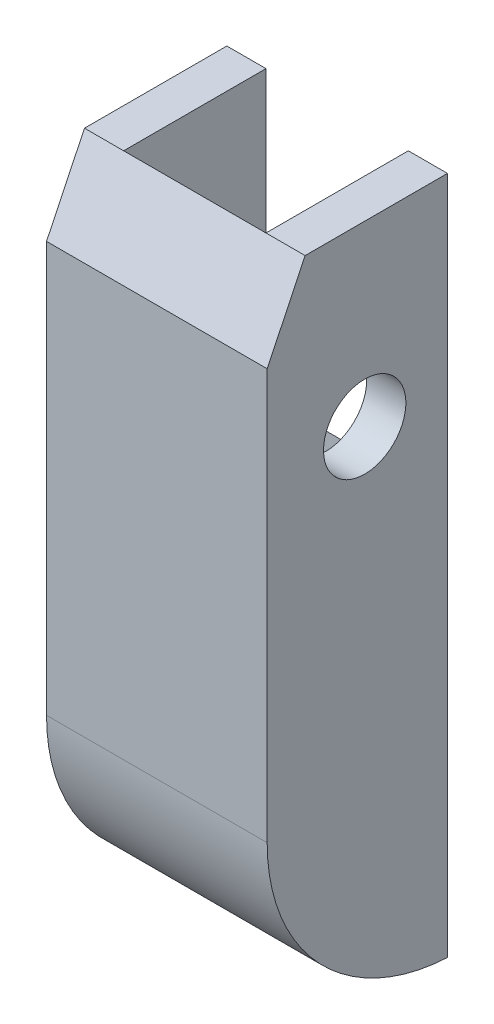
from build123d import *

# Parameters (mm, degrees)
SKETCH1_W               = 11.811
SKETCH1_H               = 45.98924
BOSS_EXTRUDE1_DEPTH     = 9.652
FILLET5_R               = 4.826
SKETCH2_W               = 7.62
SKETCH2_H               = 22.352
CUT_EXTRUDE1_DEPTH      = 7.62
CUT_EXTRUDE2_DEPTH      = 49.452771033
CUT_EXTRUDE2_DEPTH_BACK = 49.452771033
SKETCH3_R               = 2.20345
FILLET4_R               = 4.826
FILLET6_R               = 10.16
CUT_EXTRUDE3_DEPTH      = 49.452771033
CUT_EXTRUDE4_DEPTH      = 7.62
BOSS_EXTRUDE2_DEPTH     = 7.62


with BuildPart() as part:
    # Sketch1 → Boss-Extrude1 (new body)
    with BuildSketch(Plane.XY):
        with Locations((5.9055, 22.99462)):
            Rectangle(SKETCH1_W, SKETCH1_H)
    extrude(amount=BOSS_EXTRUDE1_DEPTH)

    # Fillet5
    fillet5_edges = [part.edges().sort_by_distance(p)[0] for p in [
        (5.9055, 45.98924, 0),
    ]]
    fillet(fillet5_edges, radius=FILLET5_R)

    # Sketch2 → Cut-Extrude1 (cut)
    with BuildSketch(Plane(origin=(0, 0, 0), x_dir=(-1, 0, 0), z_dir=(0, 0, -1))):
        with Locations((-5.9055, 34.81324)):
            Rectangle(SKETCH2_W, SKETCH2_H)
    extrude(amount=-CUT_EXTRUDE1_DEPTH, mode=Mode.SUBTRACT)

    # Sketch3 → Cut-Extrude2 (cut, two sides: drawn at the far end of the back side and taken through both)
    with BuildSketch(Plane.ZY.offset(-CUT_EXTRUDE2_DEPTH_BACK)):
        with Locations((4.4323, 26.82494)):
            Circle(SKETCH3_R)
    extrude(amount=CUT_EXTRUDE2_DEPTH + CUT_EXTRUDE2_DEPTH_BACK, mode=Mode.SUBTRACT)

    # Fillet4
    # the kernel refuses this fillet: 4.826 mm, written as the material it takes off along each edge
    with BuildSketch(Plane(origin=(23.876, 45.98924, 9.652), x_dir=(0, 0, -1), z_dir=(-1, 0, 0))) as fillet4_piece_1:
        with BuildLine():
            CenterArc((FILLET4_R, FILLET4_R), FILLET4_R, 180, 90)
            Line((0, FILLET4_R), (0, 0))
            Line((0, 0), (FILLET4_R, 0))
        make_face()
    extrude(amount=35.941, mode=Mode.SUBTRACT)

    # Fillet6
    # the kernel refuses this fillet: 10.16 mm, written as the material it takes off along each edge
    with BuildSketch(Plane(origin=(-25.368230131, 0, 9.652), x_dir=(0, 1, 0), z_dir=(1, 0, 0))) as fillet6_piece_1:
        with BuildLine():
            CenterArc((10.147292053, -10.16), FILLET6_R, 90, 87.134016017)
            Line((0, -9.652), (-0.202945841, -9.64184))
            ThreePointArc((-0.202945841, -9.64184), (-0.2032, -4.826), (-0.2032, 0))
            Line((-0.2032, 0), (0, 0.2032))
            Line((0, 0.2032), (10.147292053, 0.2032))
            Line((10.147292053, 0.2032), (10.147292053, 0))
        make_face()
    extrude(amount=62.547460263, mode=Mode.SUBTRACT)

    # Sketch4 → Cut-Extrude3 (cut, through all)
    with BuildSketch(Plane(origin=(11.811, 0, 0), x_dir=(0, 0, -1), z_dir=(1, 0, 0))):
        Polygon((-9.652, 32.118813088), (-7.62, 36.34994), (0, 36.34994), (0, 45.98924), (-9.652, 45.98924), align=None)
    extrude(amount=-CUT_EXTRUDE3_DEPTH, mode=Mode.SUBTRACT)

    # Sketch5 → Cut-Extrude4 (cut)
    with BuildSketch(Plane.ZY.offset(-9.7155)):
        Polygon((0, 21.160076085), (5.158068358, 23.63724), (0, 23.63724), align=None)
    extrude(amount=CUT_EXTRUDE4_DEPTH, mode=Mode.SUBTRACT)

    # Sketch5<3> → Boss-Extrude2 (add)
    with BuildSketch(Plane.ZY.offset(-9.7155)):
        with BuildLine():
            Line((5.812301369, 23.951435604), (5.158068358, 23.63724))
            Line((5.158068358, 23.63724), (7.62, 23.63724))
            Line((7.62, 23.63724), (7.62, 26.82494))
            ThreePointArc((7.62, 26.82494), (7.130490287, 25.127530072), (5.812301369, 23.951435604))
        make_face()
    extrude(amount=BOSS_EXTRUDE2_DEPTH)


solid = part.part
